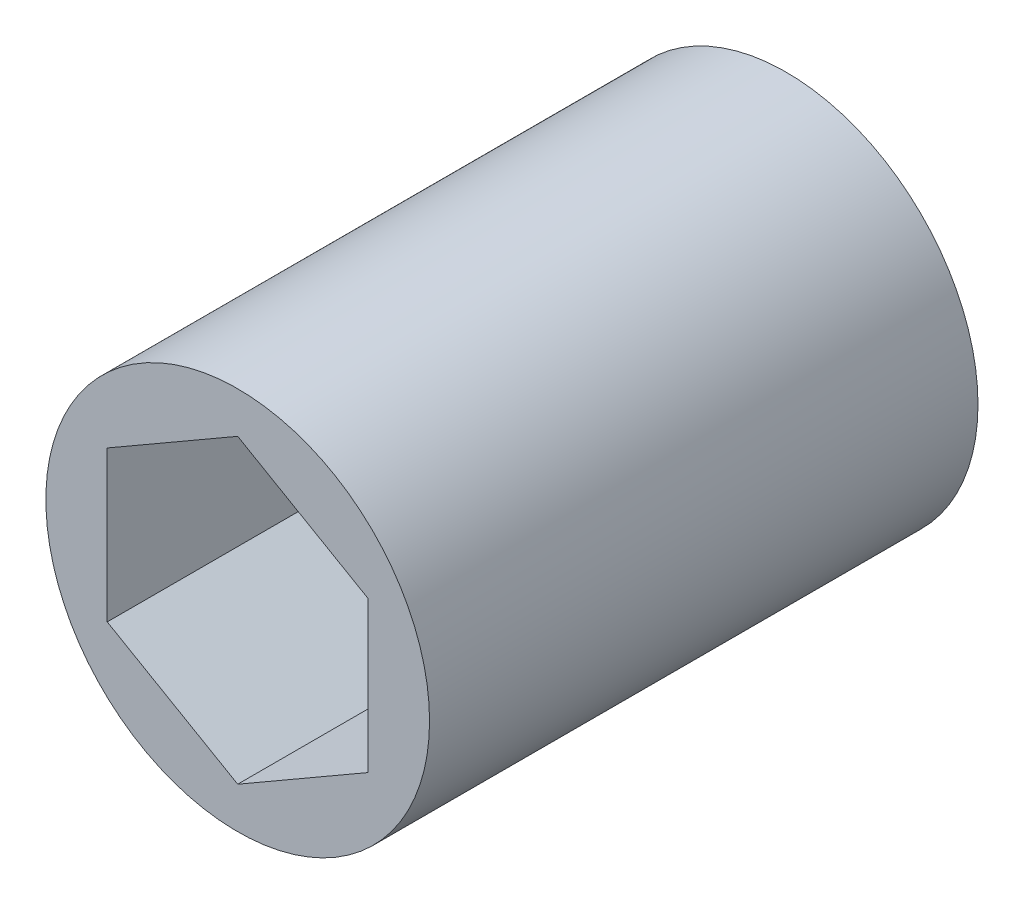
from build123d import *

# Parameters (mm, degrees)
SKETCH1_R           = 9.525
BOSS_EXTRUDE1_DEPTH = 13.6144


with BuildPart() as part:
    # Sketch1 → Boss-Extrude1 (new, symmetric)
    with BuildSketch(Plane.XY):
        Circle(SKETCH1_R)
        Polygon((0, 7.478995387), (-6.477, 3.739497694), (-6.477, -3.739497694), (0, -7.478995387), (6.477, -3.739497694), (6.477, 3.739497694), align=None, mode=Mode.SUBTRACT)
    extrude(amount=BOSS_EXTRUDE1_DEPTH, both=True)


solid = part.part
